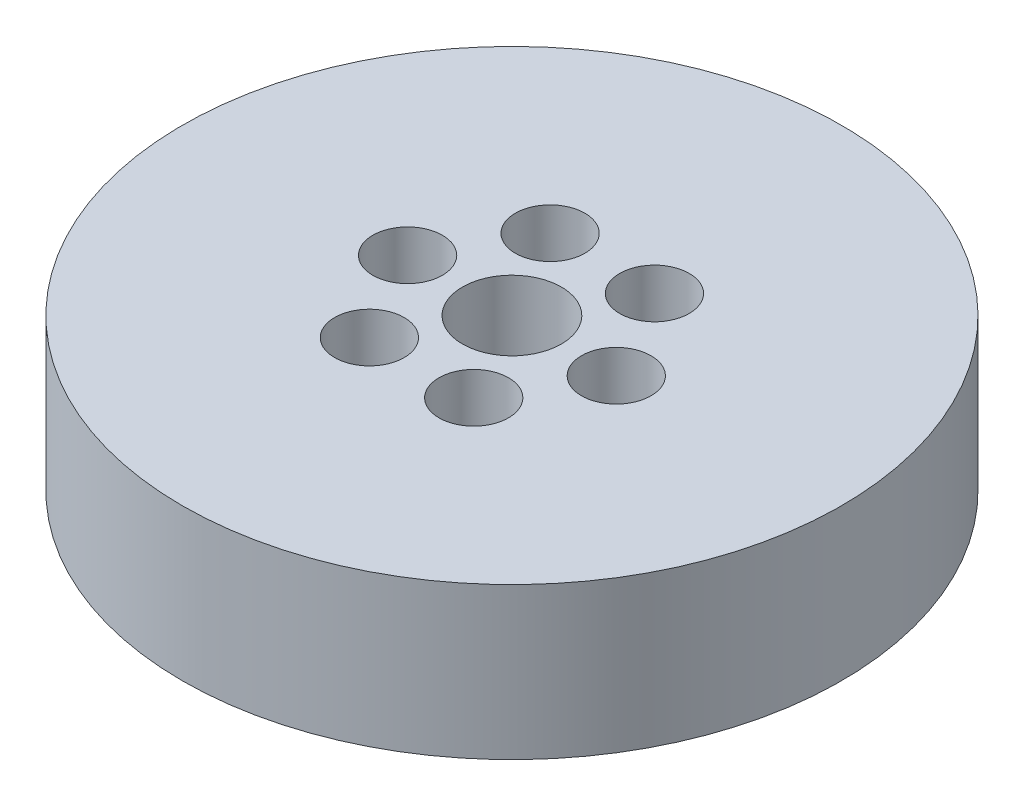
from build123d import *

# Parameters (mm, degrees)
SKETCH1_R           = 50
BOSS_EXTRUDE1_DEPTH = 23
SKETCH2_R           = 7.5
CUT_EXTRUDE1_DEPTH  = 75.35724578
SKETCH3_R           = 5.273696223
CUT_EXTRUDE2_DEPTH  = 22.206088794
CIRPATTERN1_COUNT   = 6


with BuildPart() as part:
    # Sketch1 → Boss-Extrude1 (new body)
    with BuildSketch(Plane(origin=(0, 0, 0), x_dir=(1, 0, 0), z_dir=(0, 1, 0))):
        Circle(SKETCH1_R)
    extrude(amount=BOSS_EXTRUDE1_DEPTH)

    # Sketch2 → Cut-Extrude1 (cut, through all)
    with BuildSketch(Plane(origin=(0, 0, 0), x_dir=(1, 0, 0), z_dir=(0, 1, 0))):
        Circle(SKETCH2_R)
    extrude(amount=CUT_EXTRUDE1_DEPTH, mode=Mode.SUBTRACT)

    # Sketch3 → Cut-Extrude2 (cut)
    with BuildSketch(Plane(origin=(0, 23, 0), x_dir=(1, 0, 0), z_dir=(0, 1, 0))):
        with Locations((-15.828494859, 0)):
            Circle(SKETCH3_R)
    cut_extrude2 = extrude(amount=-CUT_EXTRUDE2_DEPTH, mode=Mode.SUBTRACT)

    # CirPattern1: Cut-Extrude2 ×6 about axis
    cirpattern1_axis = Axis((0, 0, 0), (0, 1, 0))
    for i in range(1, CIRPATTERN1_COUNT):
        add(cut_extrude2.rotate(cirpattern1_axis, i * 360 / CIRPATTERN1_COUNT), mode=Mode.SUBTRACT)


solid = part.part
